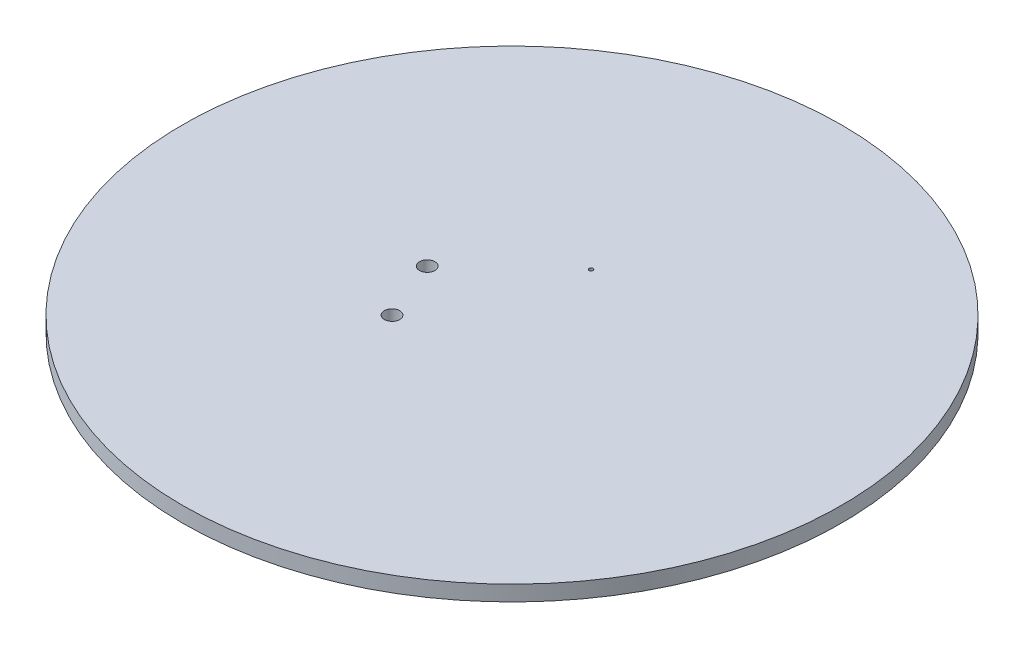
from build123d import *

# Parameters (mm, degrees)
SKETCH1_R               = 42.73
BOSS_EXTRUDE1_DEPTH     = 2
CUT_EXTRUDE1_DEPTH      = 61.462432965
CUT_EXTRUDE1_DEPTH_BACK = 61.462432965
SKETCH2_R               = 0.25
CUT_EXTRUDE2_DEPTH      = 61.462432965
CUT_EXTRUDE2_DEPTH_BACK = 61.462432965
SKETCH3_R               = 1


with BuildPart() as part:
    # Sketch1 → Boss-Extrude1 (new body)
    with BuildSketch(Plane(origin=(0, 0, 0), x_dir=(1, 0, 0), z_dir=(0, 1, 0))):
        Circle(SKETCH1_R)
    extrude(amount=BOSS_EXTRUDE1_DEPTH)

    # Sketch2 → Cut-Extrude1 (cut, two sides: drawn at the far end of the back side and taken through both)
    with BuildSketch(Plane(origin=(0, 2, 0), x_dir=(1, 0, 0), z_dir=(0, 1, 0)).offset(-CUT_EXTRUDE1_DEPTH_BACK)):
        with Locations((0, 10.25)):
            Circle(SKETCH2_R)
    extrude(amount=CUT_EXTRUDE1_DEPTH + CUT_EXTRUDE1_DEPTH_BACK, mode=Mode.SUBTRACT)

    # Sketch3 → Cut-Extrude2 (cut, two sides: drawn at the far end of the back side and taken through both)
    with BuildSketch(Plane(origin=(0, 2, 0), x_dir=(1, 0, 0), z_dir=(0, 1, 0)).offset(-CUT_EXTRUDE2_DEPTH_BACK)):
        with Locations((-11, 0)):
            Circle(SKETCH3_R)
        with Locations((-7.778174593, -7.778174593)):
            Circle(SKETCH3_R)
    extrude(amount=CUT_EXTRUDE2_DEPTH + CUT_EXTRUDE2_DEPTH_BACK, mode=Mode.SUBTRACT)


solid = part.part
